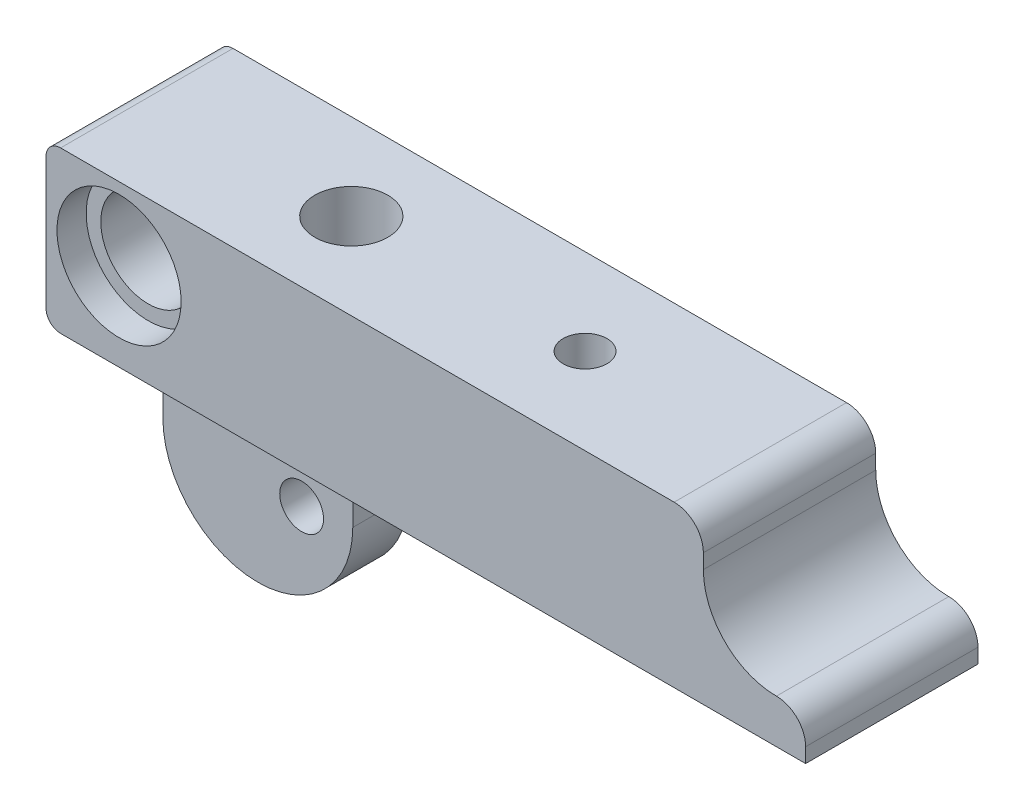
from build123d import *

# Parameters (mm, degrees)
SKETCH_1_R          = 1.5
EXTRUDE_1_DEPTH     = 3.8
EXTRUDE_2_DEPTH     = 8
SKETCH_3_R          = 3.25
CUT_EXTRUDE_1_DEPTH = 49.22207155
SKETCH_4_R          = 4.25
CUT_EXTRUDE_2_DEPTH = 2
FILLET_2_R          = 1
FILLET_3_R          = 2
FILLET_4_R          = 5
FILLET_5_R          = 2
SKETCH_5_R          = 2.5
SKETCH_5_R_2        = 1.5
CUT_EXTRUDE_3_DEPTH = 52.897670319


with BuildPart() as part:
    # 草图1 → 凸台-拉伸1 (new body)
    with BuildSketch(Plane.XY):
        with BuildLine():
            Line((35.721518987, -3), (42.721518987, -3))
            Line((42.721518987, -3), (42.721518987, 0))
            Line((42.721518987, 0), (35.721518987, 0))
            Line((35.721518987, 0), (35.721518987, 8))
            Line((35.721518987, 8), (-9.278481013, 8))
            Line((-9.278481013, 8), (-9.278481013, -3))
            Line((-9.278481013, -3), (-9.278481013, -12.5))
            ThreePointArc((-9.278481013, -12.5), (-2.778481013, -19), (3.721518987, -12.5))
            Line((3.721518987, -12.5), (3.721518987, -3))
            Line((3.721518987, -3), (35.721518987, -3))
        make_face()
        with Locations(Location((0.221518987, -13, 0), (0, 0, 180))):
            Circle(SKETCH_1_R, mode=Mode.SUBTRACT)
    extrude(amount=EXTRUDE_1_DEPTH)

    # 草图2 → 凸台-拉伸2 (add)
    with BuildSketch(Plane.XY.offset(3.8)):
        Polygon((3.721518987, -3), (-9.278481013, -3), (-9.278481013, 8), (35.721518987, 8), (35.721518987, 0), (42.721518987, 0), (42.721518987, -3), align=None)
    extrude(amount=EXTRUDE_2_DEPTH)

    # 草图3 → 切除-拉伸1 (cut, through all)
    with BuildSketch(Plane.XY.offset(11.8)):
        with Locations((-4.278481013, 3)):
            Circle(SKETCH_3_R)
    extrude(amount=-CUT_EXTRUDE_1_DEPTH, mode=Mode.SUBTRACT)

    # 草图4 → 切除-拉伸2 (cut)
    with BuildSketch(Plane.XY.offset(11.8)):
        with Locations((-4.278481013, 3)):
            Circle(SKETCH_4_R)
    extrude(amount=-CUT_EXTRUDE_2_DEPTH, mode=Mode.SUBTRACT)

    # 圆角2
    fillet_2_edges = [part.edges().sort_by_distance(p)[0] for p in [
        (-9.278481013, 8, 5.9),
        (-9.278481013, -3, 7.8),
    ]]
    fillet(fillet_2_edges, radius=FILLET_2_R)

    # 圆角3
    fillet_3_edges = [part.edges().sort_by_distance(p)[0] for p in [
        (35.721518987, 8, 5.9),
    ]]
    fillet(fillet_3_edges, radius=FILLET_3_R)

    # 圆角4
    fillet_4_edges = [part.edges().sort_by_distance(p)[0] for p in [
        (35.721518987, 0, 5.9),
    ]]
    fillet(fillet_4_edges, radius=FILLET_4_R)

    # 圆角5
    fillet_5_edges = [part.edges().sort_by_distance(p)[0] for p in [
        (42.721518987, 0, 5.9),
    ]]
    fillet(fillet_5_edges, radius=FILLET_5_R - 0.0001)  # a hair under: the kernel refuses the full size

    # 草图5 → 切除-拉伸3 (cut, through all)
    with BuildSketch(Plane(origin=(0, 8, 0), x_dir=(1, 0, 0), z_dir=(0, 1, 0))):
        with Locations(Location((5.721518987, -5.9, 0), (0, 0, 180))):
            Circle(SKETCH_5_R)
        with Locations(Location((21.721518987, -5.9, 0), (0, 0, 180))):
            Circle(SKETCH_5_R_2)
    extrude(amount=-CUT_EXTRUDE_3_DEPTH, mode=Mode.SUBTRACT)


solid = part.part
